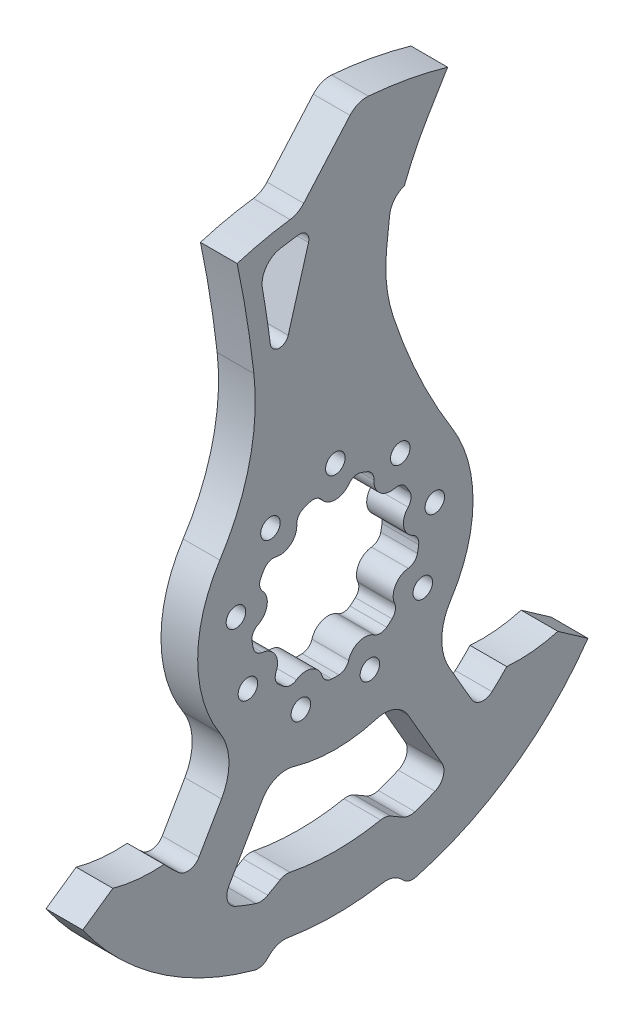
from build123d import *

# Parameters (mm, degrees)
BOSS_EXTRUDE1_DEPTH     = 6.35
CUT_EXTRUDE1_DEPTH      = 166.096382574
FILLET1_R               = 7.62
FILLET4_R               = 19.05
FILLET2_R               = 4.572
CUT_EXTRUDE2_DEPTH      = 165.894962691
FILLET3_R               = 5.08
FILLET5_R               = 9.525
CUT_EXTRUDE4_DEPTH      = 165.894962691
F_1_4_CLEARANCE_HOLE1_D = 6.7564
CIRPATTERN1_COUNT       = 9


with BuildPart() as part:
    # Sketch2 → Boss-Extrude1 (new, symmetric)
    with BuildSketch(Plane(origin=(0, 0, 0), x_dir=(0, 0, -1), z_dir=(1, 0, 0))):
        with BuildLine():
            Line((38.857972086, 134.186988957), (32.288511437, 123.318125779))
            ThreePointArc((32.288511437, 123.318125779), (27.710359244, 114.938607951), (23.879951403, 106.191964463))
            Line((23.879951403, 106.191964463), (19.233747032, 104.137898998))
            Line((19.233747032, 104.137898998), (17.741690169, 90.290745696))
            ThreePointArc((17.741690169, 90.290745696), (17.728604087, 79.52900815), (19.982810615, 69.005999114))
            ThreePointArc((19.982810615, 69.005999114), (28.906370723, 46.458546299), (40.452318764, 25.134648031))
            ThreePointArc((40.452318764, 25.134648031), (47.237687206, -6.06147939), (32.795747053, -34.533745818))
            Line((32.795747053, -34.533745818), (49.900086632, -64.159330998))
            ThreePointArc((49.900086632, -64.159330998), (54.760018309, -60.06478831), (59.285209805, -55.603078137))
            ThreePointArc((59.285209805, -55.603078137), (68.209440684, -55.534234835), (76.983909122, -53.904713488))
            Line((76.983909122, -53.904713488), (87.387140085, -61.18913423))
            ThreePointArc((87.387140085, -61.18913423), (60.250819498, -88.036703424), (25.4, -103.612076516))
            Line((25.4, -103.612076516), (20.08663208, -98.298708596))
            ThreePointArc((20.08663208, -98.298708596), (0, -100.33), (-20.08663208, -98.298708596))
            Line((-20.08663208, -98.298708596), (-25.4, -103.612076516))
            ThreePointArc((-25.4, -103.612076516), (-60.250819498, -88.036703424), (-87.387140085, -61.18913423))
            Line((-87.387140085, -61.18913423), (-76.983909122, -53.904713488))
            ThreePointArc((-76.983909122, -53.904713488), (-68.209440684, -55.534234835), (-59.285209805, -55.603078137))
            ThreePointArc((-59.285209805, -55.603078137), (-54.760018309, -60.06478831), (-49.900086632, -64.159330998))
            Line((-49.900086632, -64.159330998), (-32.795747053, -34.533745818))
            ThreePointArc((-32.795747053, -34.533745818), (-47.29370877, -5.607649758), (-39.962224525, 25.90677973))
            ThreePointArc((-39.962224525, 25.90677973), (-29.733104482, 49.880584834), (-28.182036035, 75.899278396))
            ThreePointArc((-28.182036035, 75.899278396), (-30.650883036, 93.914203021), (-33.97643981, 111.790818665))
            ThreePointArc((-33.97643981, 111.790818665), (-23.520692105, 114.448078371), (-12.864423742, 116.12963533))
            Line((-12.864423742, 116.12963533), (7.554913188, 139.495567265))
            ThreePointArc((7.554913188, 139.495567265), (23.357744557, 137.733459149), (38.857972086, 134.186988957))
        make_face()
    extrude(amount=BOSS_EXTRUDE1_DEPTH, both=True)

    # Sketch3 → Cut-Extrude1 (cut, through all)
    with BuildSketch(Plane(origin=(6.35, 0, 0), x_dir=(0, 0, -1), z_dir=(1, 0, 0))):
        with BuildLine():
            Line((-9.285141158, 105.720620362), (-16.311280791, 81.457477673))
            ThreePointArc((-16.311280791, 81.457477673), (-19.607878955, 79.17522742), (-22.510739472, 81.941023235))
            ThreePointArc((-22.510739472, 81.941023235), (-24.333905773, 94.627290323), (-26.575778708, 107.246296375))
            ThreePointArc((-26.575778708, 107.246296375), (-19.677886455, 108.723598564), (-12.699781708, 109.757713372))
            ThreePointArc((-12.699781708, 109.757713372), (-9.910690992, 108.654146335), (-9.285141158, 105.720620362))
        make_face()
    extrude(amount=-CUT_EXTRUDE1_DEPTH, mode=Mode.SUBTRACT)

    # Fillet1
    fillet1_edges = [part.edges().sort_by_distance(p)[0] for p in [
        (0, 104.137898998, -19.233747032),
        (0, 107.246296375, 26.575778708),
        (0, 139.495567265, -7.554913188),
        (0, 116.12963533, 12.864423742),
        (0, -98.298708596, -20.08663208),
        (0, -98.298708596, 20.08663208),
    ]]
    fillet(fillet1_edges, radius=FILLET1_R)

    # Fillet4
    fillet4_edges = [part.edges().sort_by_distance(p)[0] for p in [
        (0, -34.533745818, -32.795747053),
        (0, -34.533745818, 32.795747053),
    ]]
    fillet(fillet4_edges, radius=FILLET4_R)

    # Fillet2
    fillet2_edges = [part.edges().sort_by_distance(p)[0] for p in [
        (0, -103.612076516, 25.4),
        (0, -103.612076516, -25.4),
        (0, -64.159330998, -49.900086632),
        (0, -64.159330998, 49.900086632),
    ]]
    fillet(fillet2_edges, radius=FILLET2_R)

    # Sketch4 → Cut-Extrude2 (cut, through all)
    with BuildSketch(Plane(origin=(6.35, 0, 0), x_dir=(0, 0, -1), z_dir=(1, 0, 0))):
        with BuildLine():
            Line((-21.184299428, -46.172128582), (-39.645963646, -78.148669001))
            ThreePointArc((-39.645963646, -78.148669001), (-32.613253082, -81.335063923), (-25.327366164, -83.890055568))
            Line((-25.327366164, -83.890055568), (-17.5035126, -79.372951606))
            ThreePointArc((-17.5035126, -79.372951606), (-8.803547394, -80.801831373), (0, -81.28))
            Line((0, -81.28), (0, -50.8))
            ThreePointArc((0, -50.8), (-10.841952501, -49.629548315), (-21.184299428, -46.172128582))
        make_face()
    cut_extrude2 = extrude(amount=-CUT_EXTRUDE2_DEPTH, mode=Mode.SUBTRACT)

    # Mirror1: Cut-Extrude2 across plane
    add(cut_extrude2.mirror(Plane(origin=(-6.35, -81.28, 0), x_dir=(1, 0, 0), z_dir=(0, 0, -1))), mode=Mode.SUBTRACT)

    # Fillet3
    fillet3_edges = [part.edges().sort_by_distance(p)[0] for p in [
        (0, -78.148669001, -39.645963646),
        (0, -83.890055568, -25.327366164),
        (0, -79.372951606, -17.5035126),
        (0, -79.372951606, 17.5035126),
        (0, -83.890055568, 25.327366164),
        (0, -78.148669001, 39.645963646),
    ]]
    fillet(fillet3_edges, radius=FILLET3_R)

    # Fillet5
    fillet5_edges = [part.edges().sort_by_distance(p)[0] for p in [
        (0, -46.172128582, -21.184299428),
        (0, -46.172128582, 21.184299428),
    ]]
    fillet(fillet5_edges, radius=FILLET5_R)

    # Sketch5 → Cut-Extrude4 (cut, through all)
    with BuildSketch(Plane.ZY.offset(6.35)):
        with BuildLine():
            ThreePointArc((-24.555546715, 15.583517399), (-25.186616818, 14.5415), (-25.773495305, 13.47396856))
            ThreePointArc((-25.773495305, 13.47396856), (-26.156143025, 11.250711308), (-25.170636894, 9.221408534))
            ThreePointArc((-25.170636894, 9.221408534), (-23.638340496, 4.168077209), (-26.806569218, -0.056424714))
            ThreePointArc((-26.806569218, -0.056424714), (-28.426704483, -1.626282609), (-28.827532008, -3.84633427))
            ThreePointArc((-28.827532008, -3.84633427), (-28.641163881, -5.050209951), (-28.404542902, -6.245224698))
            ThreePointArc((-28.404542902, -6.245224698), (-27.268585847, -8.194299775), (-25.209233672, -9.115364758))
            ThreePointArc((-25.209233672, -9.115364758), (-20.787207767, -12.0015), (-20.498754281, -17.274154391))
            ThreePointArc((-20.498754281, -17.274154391), (-20.730764695, -19.518138181), (-19.610794692, -21.476443387))
            ThreePointArc((-19.610794692, -21.476443387), (-18.694192053, -22.278870539), (-17.744789194, -23.042207912))
            ThreePointArc((-17.744789194, -23.042207912), (-15.621754294, -23.805106924), (-13.452149845, -23.186957574))
            ThreePointArc((-13.452149845, -23.186957574), (-8.2095095, -22.555441977), (-4.599344398, -26.409115247))
            ThreePointArc((-4.599344398, -26.409115247), (-3.334669709, -28.277239979), (-1.21794859, -29.057485959))
            ThreePointArc((-1.21794859, -29.057485959), (0, -29.083), (1.21794859, -29.057485959))
            ThreePointArc((1.21794859, -29.057485959), (3.334669709, -28.277239979), (4.599344398, -26.409115247))
            ThreePointArc((4.599344398, -26.409115247), (8.2095095, -22.555441977), (13.452149845, -23.186957574))
            ThreePointArc((13.452149845, -23.186957574), (15.621754294, -23.805106924), (17.744789194, -23.042207912))
            ThreePointArc((17.744789194, -23.042207912), (18.694192053, -22.278870539), (19.610794692, -21.476443387))
            ThreePointArc((19.610794692, -21.476443387), (20.730764695, -19.518138181), (20.498754281, -17.274154391))
            ThreePointArc((20.498754281, -17.274154391), (20.787207767, -12.0015), (25.209233672, -9.115364758))
            ThreePointArc((25.209233672, -9.115364758), (27.268585847, -8.194299775), (28.404542902, -6.245224698))
            ThreePointArc((28.404542902, -6.245224698), (28.641163881, -5.050209951), (28.827532008, -3.84633427))
            ThreePointArc((28.827532008, -3.84633427), (28.426704483, -1.626282609), (26.806569218, -0.056424714))
            ThreePointArc((26.806569218, -0.056424714), (23.638340496, 4.168077209), (25.170636894, 9.221408534))
            ThreePointArc((25.170636894, 9.221408534), (26.156143025, 11.250711308), (25.773495305, 13.47396856))
            ThreePointArc((25.773495305, 13.47396856), (25.186616818, 14.5415), (24.555546715, 15.583517399))
            ThreePointArc((24.555546715, 15.583517399), (22.821473316, 17.026528671), (20.571292496, 17.187706713))
            ThreePointArc((20.571292496, 17.187706713), (15.428830995, 18.387364768), (13.354419373, 23.243382288))
            ThreePointArc((13.354419373, 23.243382288), (12.804950189, 25.431389533), (11.082742815, 26.888542183))
            ThreePointArc((11.082742815, 26.888542183), (9.946971828, 27.32908049), (8.79374821, 27.721668085))
            ThreePointArc((8.79374821, 27.721668085), (6.537821152, 27.712437956), (4.71047939, 26.389519149))
            ThreePointArc((4.71047939, 26.389519149), (0, 24.003), (-4.71047939, 26.389519149))
            ThreePointArc((-4.71047939, 26.389519149), (-6.537821152, 27.712437956), (-8.79374821, 27.721668085))
            ThreePointArc((-8.79374821, 27.721668085), (-9.946971828, 27.32908049), (-11.082742815, 26.888542183))
            ThreePointArc((-11.082742815, 26.888542183), (-12.804950189, 25.431389533), (-13.354419373, 23.243382288))
            ThreePointArc((-13.354419373, 23.243382288), (-15.428830995, 18.387364768), (-20.571292496, 17.187706713))
            ThreePointArc((-20.571292496, 17.187706713), (-22.821473316, 17.026528671), (-24.555546715, 15.583517399))
        make_face()
    extrude(amount=-CUT_EXTRUDE4_DEPTH, mode=Mode.SUBTRACT)

    # 1/4 Clearance Hole1 (through all)
    with Locations(Plane(origin=(6.35, 0, 0), x_dir=(0, 0, -1), z_dir=(1, 0, 0))):
        with Locations((0, 34.925)):
            f_1_4_clearance_hole1 = Hole(F_1_4_CLEARANCE_HOLE1_D / 2)

    # CirPattern1: 1/4 Clearance Hole1 ×9 about axis
    cirpattern1_axis = Axis((-6.985, 0, 0), (1, 0, 0))
    for i in range(1, CIRPATTERN1_COUNT):
        add(f_1_4_clearance_hole1.rotate(cirpattern1_axis, i * 360 / CIRPATTERN1_COUNT), mode=Mode.SUBTRACT)


solid = part.part
